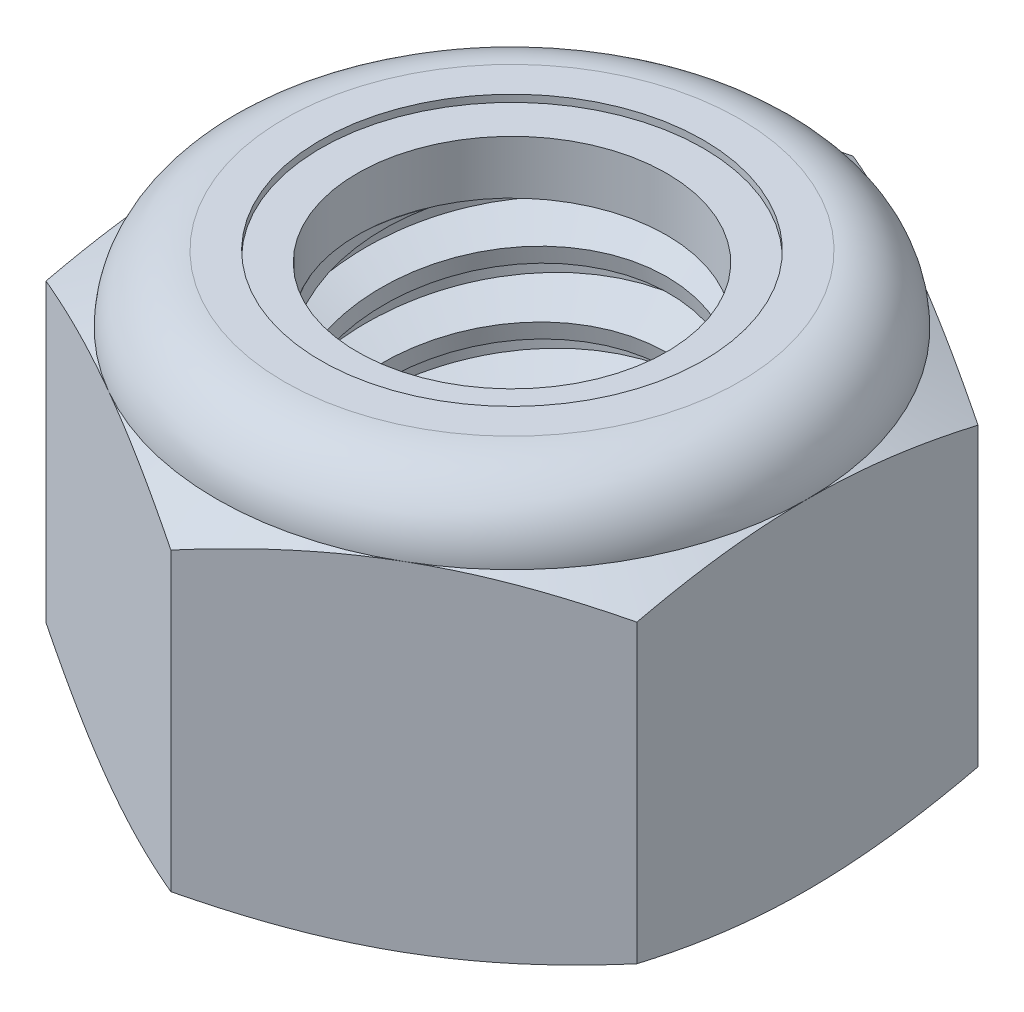
from build123d import *

# Parameters (mm, degrees)
EXTRUDE1_DEPTH       = 8.73125
SKETCH2_W            = 3.96875
SKETCH2_H            = 8.73125
LPATTERN1_COUNT      = 6
LPATTERN1_PITCH      = 1.411111111
LPATTERN1_COUNT_DIR2 = 2
LPATTERN1_PITCH_DIR2 = 1.411111111


with BuildPart() as part:
    # Sketch1 → Extrude1 (new body)
    with BuildSketch(Plane(origin=(0, 0, 0), x_dir=(1, 0, 0), z_dir=(0, 1, 0))):
        Polygon((0, 7.332348419), (-6.35, 3.666174209), (-6.35, -3.666174209), (0, -7.332348419), (6.35, -3.666174209), (6.35, 3.666174209), align=None)
    extrude(amount=EXTRUDE1_DEPTH)

    # Sketch4 → Cut-Revolve2 (revolve, cut)
    with BuildSketch(Plane(origin=(0, 0, 0), x_dir=(0, 0, -1), z_dir=(1, 0, 0))):
        Polygon((0, 8.73125), (3.96875, 8.73125), (3.324813425, 8.430977444), (3.324813425, 0.300272556), (3.96875, 0), (0, 0), align=None)
    revolve(axis=Axis((0, 8.73125, 0), (0, 1, 0)), mode=Mode.SUBTRACT)


with BuildPart() as body_2:
    # Sketch2 → Revolve1 (revolve)
    with BuildSketch(Plane(origin=(0, 0, 0), x_dir=(0, 0, -1), z_dir=(1, 0, 0))):
        with Locations((1.984375, 4.365625)):
            Rectangle(SKETCH2_W, SKETCH2_H)
    revolve(axis=Axis((0, -3.96875, 0), (0, 1, 0)))

    # Sketch3 → Cut-Revolve1 (revolve, cut)
    with BuildSketch(Plane(origin=(0, 0, 0), x_dir=(0, 0, -1), z_dir=(1, 0, 0))):
        Polygon((3.999623935, 8.557584113), (4.215741483, 7.341922906), (3.386561296, 7.642399561), (3.324813425, 7.989731334), align=None)
    cut_revolve1 = revolve(axis=Axis((0, 8.73125, 0.268755768), (0, -0.9845625077859067, -0.17503333471749477)), mode=Mode.SUBTRACT)

    # LPattern1: Cut-Revolve1 6 × 2
    with Locations(*[Vector(0, -1, 0) * (i * LPATTERN1_PITCH) + Vector(0, 1, 0) * (j * LPATTERN1_PITCH_DIR2) for i in range(LPATTERN1_COUNT) for j in range(LPATTERN1_COUNT_DIR2) if (i, j) != (0, 0)]):
        add(cut_revolve1, mode=Mode.SUBTRACT)


with BuildPart() as part_1:
    add(part.part)

    # Combine1: cut body 2
    add(body_2.part, mode=Mode.SUBTRACT)

    # Sketch5 → Cut-Revolve3 (revolve, cut)
    with BuildSketch(Plane(origin=(0, 0, 0), x_dir=(0, 0, -1), z_dir=(1, 0, 0))):
        with BuildLine():
            Line((0, 0), (6.35, 0))
            Line((6.35, 0), (7.332348419, 0.458076591))
            Line((7.332348419, 0.458076591), (7.332348419, 6.817965076))
            Line((7.332348419, 6.817965076), (6.35, 7.276041667))
            ThreePointArc((6.35, 7.276041667), (5.923779347, 8.305029347), (4.894791667, 8.73125))
            Line((4.894791667, 8.73125), (4.894791667, 10.00125))
            Line((4.894791667, 10.00125), (8.602348419, 10.00125))
            Line((8.602348419, 10.00125), (8.602348419, -1.27))
            Line((8.602348419, -1.27), (0, -1.27))
            Line((0, -1.27), (0, 0))
        make_face()
    revolve(axis=Axis((0, 0, 0), (0, 1, 0)), mode=Mode.SUBTRACT)

    # Sketch6 → Cut-Revolve4 (revolve, cut)
    with BuildSketch(Plane(origin=(0, 0, 0), x_dir=(0, 0, -1), z_dir=(1, 0, 0))):
        with BuildLine():
            Line((0, 7.276041667), (6.1976, 7.276041667))
            ThreePointArc((6.1976, 7.276041667), (5.816016274, 8.197266274), (4.894791667, 8.57885))
            Line((4.894791667, 8.57885), (4.109802546, 8.57885))
            Line((4.109802546, 8.57885), (4.109802546, 10.00125))
            Line((4.109802546, 10.00125), (0, 10.00125))
            Line((0, 10.00125), (0, 7.276041667))
        make_face()
    revolve(axis=Axis((0, 10.00125, 0), (0, 1, 0)), mode=Mode.SUBTRACT)


with BuildPart() as body_2_2:
    # Sketch7 → Revolve2 (revolve)
    with BuildSketch(Plane(origin=(0, 0, 0), x_dir=(0, 0, -1), z_dir=(1, 0, 0))):
        with BuildLine():
            Line((3.324813425, 7.352241667), (6.119030844, 7.352241667))
            ThreePointArc((6.119030844, 7.352241667), (5.734762038, 8.169919611), (4.894791667, 8.50265))
            Line((4.894791667, 8.50265), (3.324813425, 8.50265))
            Line((3.324813425, 8.50265), (3.324813425, 7.352241667))
        make_face()
    revolve(axis=Axis((0, 7.352241667, 0), (0, 1, 0)))


solid = Compound([part_1.part, body_2_2.part])
